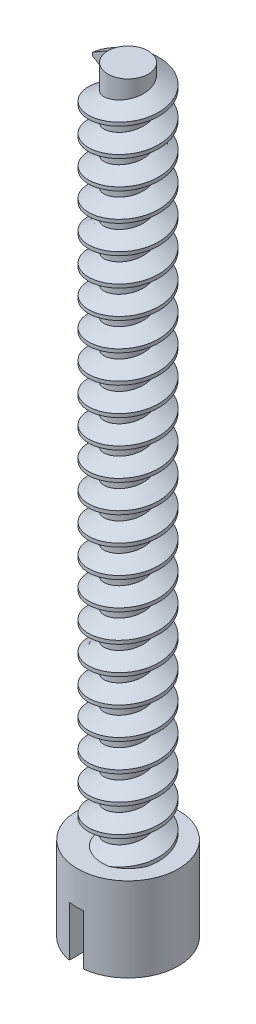
from build123d import *

# Parameters (mm, degrees)
SKETCH1_R           = 3.81
BOSS_EXTRUDE1_DEPTH = 6.35
SKETCH2_R           = 1.524
BOSS_EXTRUDE3_DEPTH = 50.8
THREAD1_PITCH       = 2.116666667
CUT_EXTRUDE2_DEPTH  = 3.81


with BuildPart() as part:
    # Sketch1 → Boss-Extrude1 (new body)
    with BuildSketch(Plane(origin=(0, 0, 0), x_dir=(1, 0, 0), z_dir=(0, 1, 0))):
        with Locations(Location((0, 0, 0), (0, 0, 270))):
            Circle(SKETCH1_R)
    extrude(amount=BOSS_EXTRUDE1_DEPTH)

    # Sketch2 → Boss-Extrude3 (add)
    with BuildSketch(Plane(origin=(0, 6.35, 0), x_dir=(1, 0, 0), z_dir=(0, 1, 0))):
        with Locations(Location((0, 0, 0), (0, 0, 270))):
            Circle(SKETCH2_R)
    extrude(amount=BOSS_EXTRUDE3_DEPTH)

    # Thread1: the profile of Thread Profile1 profile screwed along a right-hand helix of 24 turns, 10 arcs to a turn; built about Z, then put on its axis
    thread1_z = Axis((0, 0, 0), (0, 0, 1))
    thread1_corners = [(1.5237, 0, -0.000173205), (2.669679435, 0, 0.66145833), (2.669679435, 0, 0.926041664), (1.5237, 0, 1.587673199)]
    with BuildLine(mode=Mode.PRIVATE) as thread1_profile:
        Line(thread1_corners[0], thread1_corners[1])
        Line(thread1_corners[1], thread1_corners[2])
        Line(thread1_corners[2], thread1_corners[3])
        Line(thread1_corners[3], thread1_corners[0])
    thread1_cap = Face(thread1_profile.wire())
    thread1_turn_angles = [0, 18, 36, 54, 72, 90, 108, 126, 144, 162, 180, 198, 216, 234, 252, 270, 288, 306, 324, 342, 360]
    thread1_turn_weights = [1, 0.9510565162951535, 1, 0.9510565162951535, 1, 0.9510565162951535, 1, 0.9510565162951535, 1, 0.9510565162951535, 1, 0.9510565162951535, 1, 0.9510565162951535, 1, 0.9510565162951535, 1, 0.9510565162951535, 1, 0.9510565162951535, 1]
    thread1_turn_rails = [Edge.make_bspline([Vector(p[0], p[1], 0).rotate(thread1_z, thread1_turn_angles[k]) / thread1_turn_weights[k] + Vector(0, 0, p[2] + THREAD1_PITCH * thread1_turn_angles[k] / 360) for k in range(21)], [0, 0, 0, 1, 1, 2, 2, 3, 3, 4, 4, 5, 5, 6, 6, 7, 7, 8, 8, 9, 9, 10, 10, 10], 2, thread1_turn_weights) for p in thread1_corners]
    thread1_turn_sides = [Face.make_surface_from_curves(thread1_turn_rails[p[0]], thread1_turn_rails[p[1]]) for p in [(0, 1), (1, 2), (2, 3), (3, 0)]]
    thread1 = Plane(origin=(0, 57.15, 0), x_dir=(-1, 0, 0), z_dir=(0, -1, 0)) * Solid(Shell([*[p.moved(Location((0, 0, THREAD1_PITCH * i))) for i in range(24) for p in thread1_turn_sides], thread1_cap, thread1_cap.rotate(thread1_z, 8640).moved(Location((0, 0, THREAD1_PITCH * 8640 / 360)))]))
    add(thread1)

    # Sketch8 → Cut-Extrude2 (cut)
    with BuildSketch(Plane.XZ):
        with BuildLine():
            Line((-0.685057914, -6.312938749), (-0.685057914, 6.312938749))
            ThreePointArc((-0.685057914, 6.312938749), (0.001471461, 5.110461771), (0.411034748, 3.78776325))
            Line((0.411034748, 3.78776325), (0.411034748, -3.78776325))
            ThreePointArc((0.411034748, -3.78776325), (0.001471461, -5.110461771), (-0.685057914, -6.312938749))
        make_face()
    extrude(amount=-CUT_EXTRUDE2_DEPTH, mode=Mode.SUBTRACT)


solid = part.part
